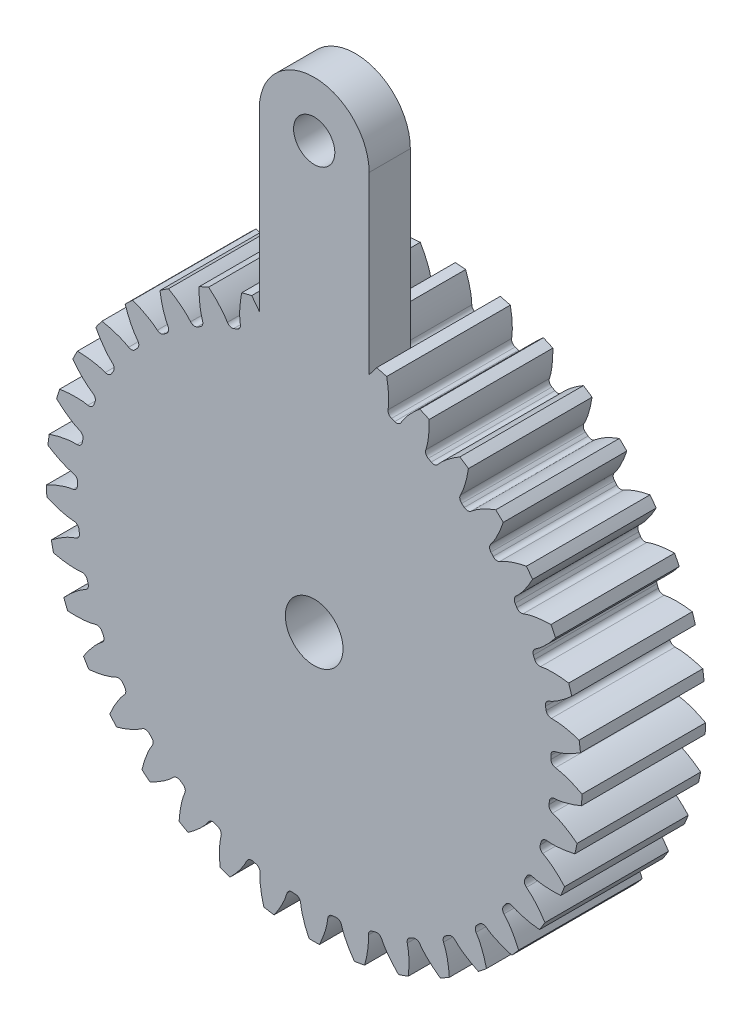
from build123d import *

# Parameters (mm, degrees)
SKETCH_1_R          = 19.5
LASHENA_DEPTH       = 9
CUT_EXTRUDEA_DEPTH  = 10
WWW_KYTOOL_CN_COUNT = 37
EXTRUDE_2_DEPTH     = 3
SKETCH_4_R          = 1.5
CUT_EXTRUDE_2_DEPTH = 41.509838332
SKETCH_5_R          = 2.1
CUT_EXTRUDE_3_DEPTH = 42.061501978


with BuildPart() as part:
    # 草图1 → LaShenA (new body)
    with BuildSketch(Plane.XY):
        Circle(SKETCH_1_R)
    extrude(amount=LASHENA_DEPTH)

    # SketchA → Cut-ExtrudeA (cut)
    with BuildSketch(Plane.XY.offset(9)):
        with BuildLine():
            ThreePointArc((0.1249143, 17.249547716), (0, 17.25), (-0.1249143, 17.249547716))
            ThreePointArc((-0.1249143, 17.249547716), (-0.368395248, 17.335514887), (-0.500725106, 17.557240247))
            add(Edge.make_bspline(
                [(-0.500725106, 17.557240247), (-0.504654552, 17.577516403), (-0.514803667, 17.62928538), (-0.529409589, 17.69861485), (-0.545520522, 17.766323591), (-0.559812494, 17.822767359), (-0.576017849, 17.88286252), (-0.594234511, 17.94656742), (-0.614580466, 18.01383262), (-0.637166484, 18.084607601), (-0.662104085, 18.158838813), (-0.689503138, 18.236470276), (-0.719472493, 18.317443428), (-0.752119733, 18.401697205), (-0.787551176, 18.489168044), (-0.82587181, 18.579789912), (-0.867185249, 18.673494338), (-0.911593676, 18.770210429), (-0.959197802, 18.86986491), (-1.010096808, 18.97238214), (-1.064388307, 19.077684152), (-1.122168285, 19.185690679), (-1.183531062, 19.296319186), (-1.248569243, 19.4094849), (-1.317373674, 19.525100849), (-1.390033372, 19.643077891), (-1.493608365, 19.805665437), (-1.575211808, 19.927457939), (-1.631562781, 20.008931386)],
                knots=[0.105238042, 0.105238042, 0.105238042, 0.105238042, 0.125625563, 0.157342855, 0.175184979, 0.194349116, 0.214835266, 0.23664343, 0.259773607, 0.284225798, 0.310000003, 0.337096221, 0.365514453, 0.395254698, 0.426316957, 0.458701229, 0.492407515, 0.527435814, 0.563786127, 0.601458453, 0.640452793, 0.680769147, 0.722407514, 0.765367894, 0.809650288, 0.855254696, 0.902181117, 1, 1, 1, 1], degree=3))
            ThreePointArc((-1.631562781, 20.008931386), (0, 20.0753414), (1.631562781, 20.008931386))
            add(Edge.make_bspline(
                [(0.500725106, 17.557240247), (0.504654552, 17.577516403), (0.514803667, 17.62928538), (0.529409589, 17.69861485), (0.545520522, 17.766323591), (0.559812494, 17.822767359), (0.576017849, 17.88286252), (0.594234511, 17.94656742), (0.614580466, 18.01383262), (0.637166484, 18.084607601), (0.662104085, 18.158838813), (0.689503138, 18.236470276), (0.719472493, 18.317443428), (0.752119733, 18.401697205), (0.787551176, 18.489168044), (0.82587181, 18.579789912), (0.867185249, 18.673494338), (0.911593676, 18.770210429), (0.959197802, 18.86986491), (1.010096808, 18.97238214), (1.064388307, 19.077684152), (1.122168285, 19.185690679), (1.183531062, 19.296319186), (1.248569243, 19.4094849), (1.317373674, 19.525100849), (1.390033372, 19.643077891), (1.493608365, 19.805665437), (1.575211808, 19.927457939), (1.631562781, 20.008931386)],
                knots=[0.105238042, 0.105238042, 0.105238042, 0.105238042, 0.125625563, 0.157342855, 0.175184979, 0.194349116, 0.214835266, 0.23664343, 0.259773607, 0.284225798, 0.310000003, 0.337096221, 0.365514453, 0.395254698, 0.426316957, 0.458701229, 0.492407515, 0.527435814, 0.563786127, 0.601458453, 0.640452793, 0.680769147, 0.722407514, 0.765367894, 0.809650288, 0.855254696, 0.902181117, 1, 1, 1, 1], degree=3))
            ThreePointArc((0.500725106, 17.557240247), (0.368395248, 17.335514887), (0.1249143, 17.249547716))
        make_face()
    cut_extrudea = extrude(amount=-CUT_EXTRUDEA_DEPTH, mode=Mode.SUBTRACT)

    # www.KYTool.cn: Cut-ExtrudeA ×37 about axis
    www_kytool_cn_axis = Axis((0, 0, -88.99), (0, 0, 1))
    for i in range(1, WWW_KYTOOL_CN_COUNT):
        add(cut_extrudea.rotate(www_kytool_cn_axis, i * 360 / WWW_KYTOOL_CN_COUNT), mode=Mode.SUBTRACT)

    # 草图3 → 凸台-拉伸2 (add)
    with BuildSketch(Plane.XY.offset(9)):
        with BuildLine():
            Line((-4, 0), (-4, 31))
            ThreePointArc((-4, 31), (0, 35), (4, 31))
            Line((4, 31), (4, 0))
            ThreePointArc((4, 0), (0, -4), (-4, 0))
        make_face()
    extrude(amount=-EXTRUDE_2_DEPTH)

    # 草图4 → 切除-拉伸2 (cut, through all)
    with BuildSketch(Plane(origin=(0, 0, 6), x_dir=(-1, 0, 0), z_dir=(0, 0, -1))):
        with Locations((0, 31)):
            Circle(SKETCH_4_R)
    extrude(amount=-CUT_EXTRUDE_2_DEPTH, mode=Mode.SUBTRACT)

    # 草图5 → 切除-拉伸3 (cut, through all)
    with BuildSketch(Plane(origin=(0, 0, 0), x_dir=(-1, 0, 0), z_dir=(0, 0, -1))):
        Circle(SKETCH_5_R)
    extrude(amount=-CUT_EXTRUDE_3_DEPTH, mode=Mode.SUBTRACT)


solid = part.part
